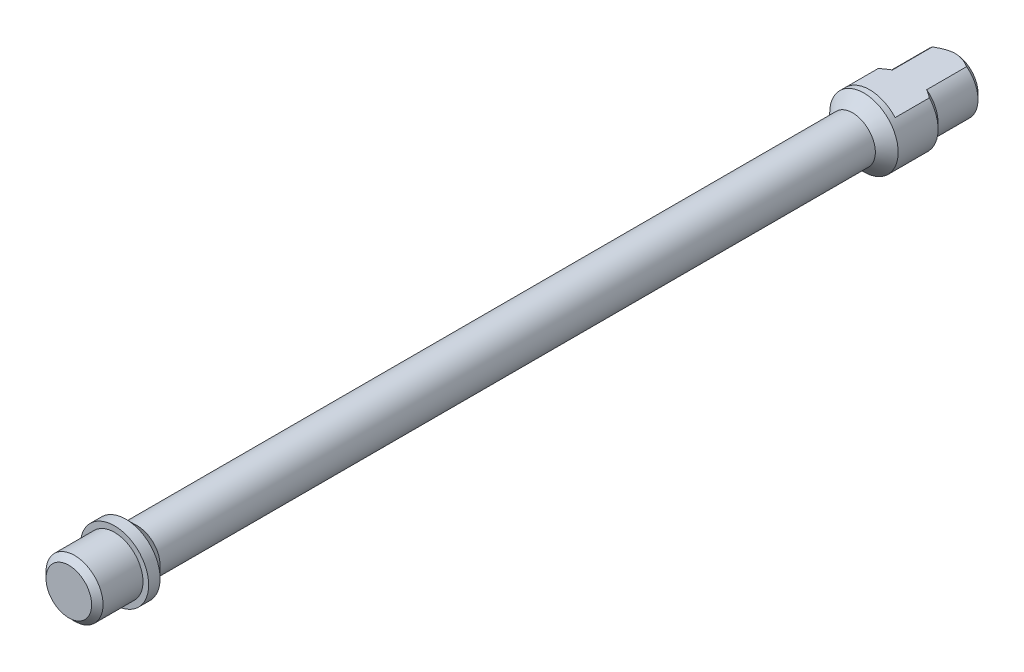
from build123d import *

# Parameters (mm, degrees)
SKETCH_1_R          = 2
EXTRUDE_1_DEPTH     = 32.35
SKETCH_2_R          = 3
EXTRUDE_2_DEPTH     = 1
SKETCH_3_R          = 2.5
EXTRUDE_3_DEPTH     = 4
EXTRUDE_START       = 4
SKETCH_4_R          = 3
EXTRUDE_4_DEPTH     = 4
SKETCH_5_R          = 2.5
EXTRUDE_5_DEPTH     = 4
CHAMFER_1_SIZE      = 0.5
CHAMFER_2_SIZE      = 0.5
SKETCH_6_W          = 6
SKETCH_6_H          = 3
CUT_EXTRUDE_6_DEPTH = 7.5
CHAMFER1_SIZE       = 1


with BuildPart() as part:
    # 草图1 → 拉伸1 (new, symmetric)
    with BuildSketch(Plane.XY):
        with Locations(Location((0, 0, 0), (0, 0, 180))):
            Circle(SKETCH_1_R)
    extrude(amount=EXTRUDE_1_DEPTH, both=True)

    # 草图2 → 拉伸2 (add)
    with BuildSketch(Plane.XY.offset(32.35)):
        Circle(SKETCH_2_R)
    extrude(amount=EXTRUDE_2_DEPTH)

    # 草图3 → 拉伸3 (add)
    with BuildSketch(Plane.XY.offset(33.35)):
        Circle(SKETCH_3_R)
    extrude(amount=EXTRUDE_3_DEPTH)

    # 草图4 → 拉伸4 (add)
    with BuildSketch(Plane(origin=(0, 0, -32.35), x_dir=(-1, 0, 0), z_dir=(0, 0, -1)).offset(EXTRUDE_START)):
        with Locations(Location((0, 0, 0), (0, 0, 180))):
            Circle(SKETCH_4_R)
    extrude(amount=-EXTRUDE_4_DEPTH)

    # 草图5 → 拉伸5 (add)
    with BuildSketch(Plane(origin=(0, 0, -36.35), x_dir=(-1, 0, 0), z_dir=(0, 0, -1)).offset(EXTRUDE_START)):
        with Locations(Location((0, 0, 0), (0, 0, 180))):
            Circle(SKETCH_5_R)
    extrude(amount=-EXTRUDE_5_DEPTH)

    # 倒角1
    chamfer_1_edges = [part.edges().sort_by_distance(p)[0] for p in [
        (-2.5, 0, 37.35),
        (-2.5, 0, -40.35),
    ]]
    chamfer(chamfer_1_edges, length=CHAMFER_1_SIZE)

    # 倒角2
    chamfer_2_edges = [part.edges().sort_by_distance(p)[0] for p in [
        (-3, 0, -36.35),
    ]]
    chamfer(chamfer_2_edges, length=CHAMFER_2_SIZE - 0.0001)  # a hair under: the kernel refuses the full size

    # 草图6 → 拉伸6 (cut)
    with BuildSketch(Plane(origin=(0, 0, -40.35), x_dir=(-1, 0, 0), z_dir=(0, 0, -1))):
        with Locations((0, 3.5)):
            Rectangle(SKETCH_6_W, SKETCH_6_H)
    extrude(amount=-CUT_EXTRUDE_6_DEPTH, mode=Mode.SUBTRACT)

    # Chamfer1
    chamfer1_edges = [part.edges().sort_by_distance(p)[0] for p in [
        (2, 0, -32.35),
        (2, 0, 32.35),
    ]]
    chamfer(chamfer1_edges, length=CHAMFER1_SIZE - 0.0001)  # a hair under: the kernel refuses the full size


solid = part.part
